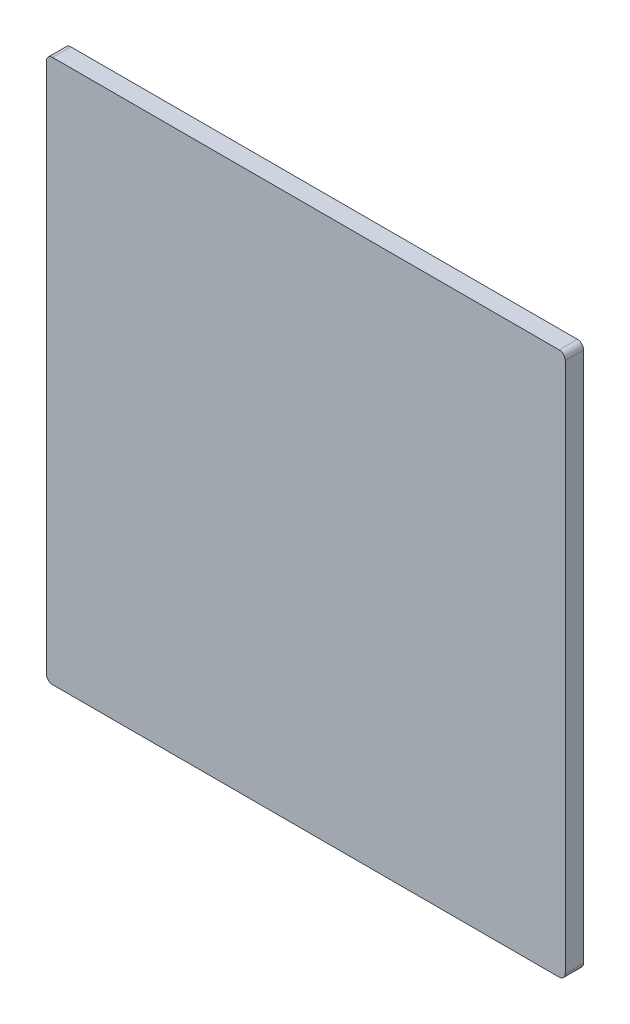
from build123d import *

# Parameters (mm, degrees)
SKETCH1_W           = 890
SKETCH1_H           = 850
BOSS_EXTRUDE1_DEPTH = 30
FILLET1_R           = 10


with BuildPart() as part:
    # Sketch1 → Boss-Extrude1 (new body)
    with BuildSketch(Plane(origin=(0, 0, 0), x_dir=(0, 1, 0), z_dir=(0, 0, 1))):
        Rectangle(SKETCH1_W, SKETCH1_H)
    extrude(amount=BOSS_EXTRUDE1_DEPTH)

    # Fillet1
    fillet1_edges = [part.edges().sort_by_distance(p)[0] for p in [
        (-425, -445, 15),
        (-425, 445, 15),
        (425, 445, 15),
        (425, -445, 15),
    ]]
    fillet(fillet1_edges, radius=FILLET1_R)


solid = part.part
